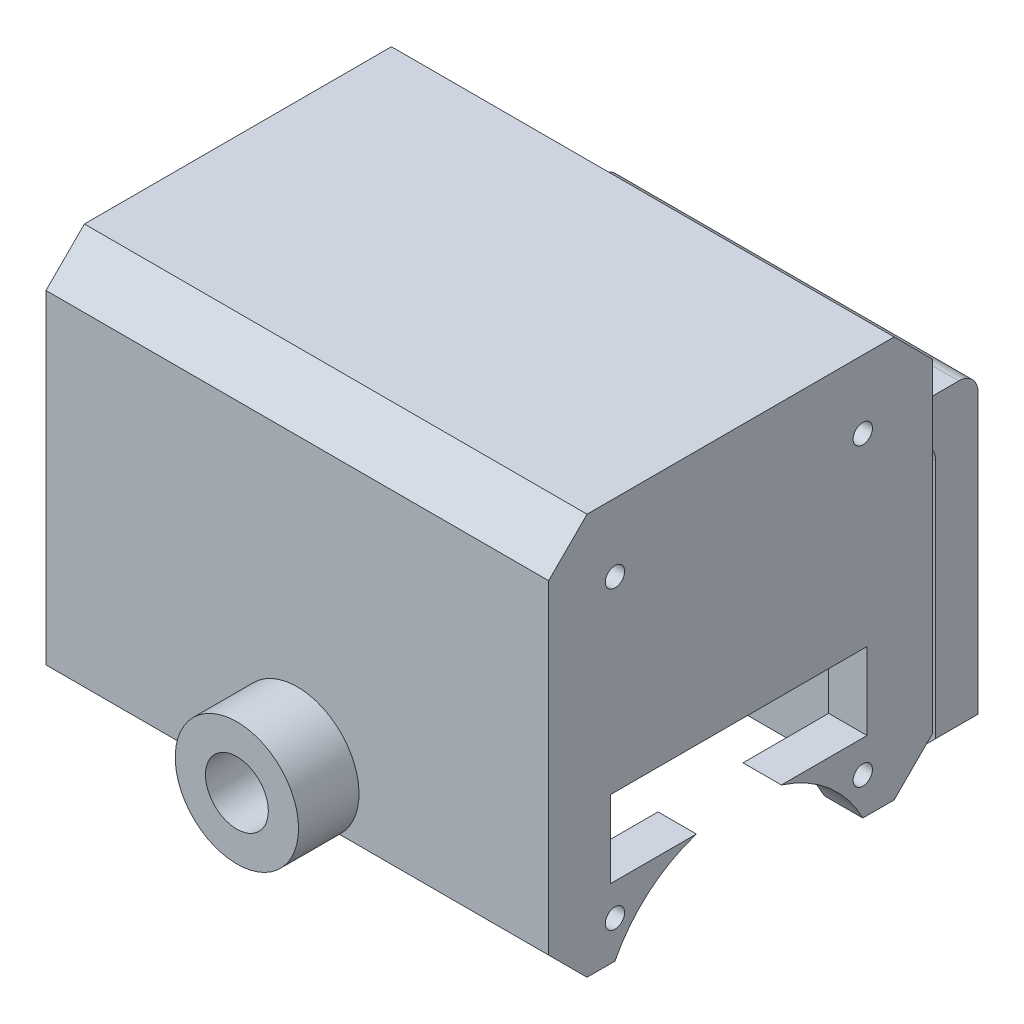
from build123d import *

# Parameters (mm, degrees)
SKETCH1_W                       = 25
SKETCH1_H                       = 30
BOSS_EXTRUDE1_DEPTH             = 3.175
SKETCH2_W                       = 25
SKETCH2_H                       = 3.175
BOSS_EXTRUDE2_DEPTH             = 41.58
SKETCH3_W                       = 3.175
SKETCH3_H                       = 25
BOSS_EXTRUDE3_DEPTH             = 30
CUT_EXTRUDE1_REACH              = 60.775
SKETCH4_R                       = 11.5
CUT_EXTRUDE2_REACH              = 60.775
SKETCH5_R                       = 0.8
CUT_EXTRUDE3_REACH              = 60.775
SKETCH6_R                       = 0.8
SKETCH6_R_2                     = 0.799851166
SKETCH6_W                       = 21.2
SKETCH6_H                       = 6.375
CUT_EXTRUDE4_REACH              = 60.775
SKETCH7_R                       = 11.5
BOSS_EXTRUDE4_DEPTH             = 0.2
SKETCH9_W                       = 41.58
SKETCH9_H                       = 33.175
BOSS_EXTRUDE5_DEPTH             = 3.175
BOSS_EXTRUDE6_DEPTH             = 0.2
SKETCH11_W                      = 41.58
SKETCH11_H                      = 33.175
BOSS_EXTRUDE7_DEPTH             = 3.175
CHAMFER1_SIZE                   = 3.175
CHAMFER2_SIZE                   = 3.175
SKETCH13_W                      = 29.58
SKETCH13_H                      = 3.175
BOSS_EXTRUDE8_DEPTH             = 6.59
BOSS_EXTRUDE9_REACH             = 59.287
SKETCH14_W                      = 29.58
SKETCH14_H                      = 3.5
BOSS_EXTRUDE9_DIRECTION_2_DEPTH = 25
CHAMFER3_SIZE                   = 3.5
FILLET1_R                       = 1.5875
FILLET2_R                       = 1.5875
CUT_EXTRUDE5_REACH              = 69.476
SKETCH16_R                      = 4.6
SKETCH20_R                      = 8
SKETCH20_R_2                    = 2.6
BOSS_EXTRUDE11_DEPTH            = 5
CUT_EXTRUDE6_START              = -21.7275
SKETCH21_R                      = 1.025
CUT_EXTRUDE6_DEPTH              = 16
BOSS_EXTRUDE12_DEPTH            = 5
BOSS_EXTRUDE12_DEPTH_BACK       = 1.2
SKETCH23_R                      = 5.1
SKETCH23_R_2                    = 2.6


with BuildPart() as part:
    # Sketch1 → Boss-Extrude1 (new body)
    with BuildSketch(Plane(origin=(0, 0, 0), x_dir=(0, 0, -1), z_dir=(1, 0, 0))):
        with Locations((12.5, 15)):
            Rectangle(SKETCH1_W, SKETCH1_H)
    extrude(amount=BOSS_EXTRUDE1_DEPTH)

    # Sketch2 → Boss-Extrude2 (add)
    with BuildSketch(Plane.ZY):
        with Locations((-12.5, 31.5875)):
            Rectangle(SKETCH2_W, SKETCH2_H)
    extrude(amount=-BOSS_EXTRUDE2_DEPTH)

    # Sketch3 → Boss-Extrude3 (add)
    with BuildSketch(Plane.XZ.offset(-30)):
        with Locations((39.9925, -12.5)):
            Rectangle(SKETCH3_W, SKETCH3_H)
    extrude(amount=BOSS_EXTRUDE3_DEPTH)

    # Sketch4 → Cut-Extrude1 (cut, up to next)
    with BuildSketch(Plane.ZY, mode=Mode.PRIVATE) as cut_extrude1_sk1:
        with Locations((-12.359999929, -5.209996254)):
            Circle(SKETCH4_R)
    cut_extrude1_tool1 = extrude(cut_extrude1_sk1.sketch, amount=-CUT_EXTRUDE1_REACH, mode=Mode.PRIVATE) & part.part
    add(cut_extrude1_tool1.solids().sort_by_distance((0, -5.209996, -12.36))[0], mode=Mode.SUBTRACT)

    # Sketch5 → Cut-Extrude2 (cut, up to next)
    with BuildSketch(Plane.ZY, mode=Mode.PRIVATE) as cut_extrude2_sk1:
        with Locations((-22.609999929, 3.090003746)):
            Circle(SKETCH5_R)
    cut_extrude2_tool1 = extrude(cut_extrude2_sk1.sketch, amount=-CUT_EXTRUDE2_REACH, mode=Mode.PRIVATE) & part.part
    # Sketch5 → Cut-Extrude2 (cut, up to next)
    with BuildSketch(Plane.ZY, mode=Mode.PRIVATE) as cut_extrude2_sk2:
        with Locations((-22.609999929, 23.790003746)):
            Circle(SKETCH5_R)
    cut_extrude2_tool2 = extrude(cut_extrude2_sk2.sketch, amount=-CUT_EXTRUDE2_REACH, mode=Mode.PRIVATE) & part.part
    # Sketch5 → Cut-Extrude2 (cut, up to next)
    with BuildSketch(Plane.ZY, mode=Mode.PRIVATE) as cut_extrude2_sk3:
        with Locations((-2.109999929, 23.790003746)):
            Circle(SKETCH5_R)
    cut_extrude2_tool3 = extrude(cut_extrude2_sk3.sketch, amount=-CUT_EXTRUDE2_REACH, mode=Mode.PRIVATE) & part.part
    # Sketch5 → Cut-Extrude2 (cut, up to next)
    with BuildSketch(Plane.ZY, mode=Mode.PRIVATE) as cut_extrude2_sk4:
        with Locations((-2.109999929, 3.090003746)):
            Circle(SKETCH5_R)
    cut_extrude2_tool4 = extrude(cut_extrude2_sk4.sketch, amount=-CUT_EXTRUDE2_REACH, mode=Mode.PRIVATE) & part.part
    add(cut_extrude2_tool1.solids().sort_by_distance((0, 3.090004, -22.61))[0], mode=Mode.SUBTRACT)
    add(cut_extrude2_tool2.solids().sort_by_distance((0, 23.790004, -22.61))[0], mode=Mode.SUBTRACT)
    add(cut_extrude2_tool3.solids().sort_by_distance((0, 23.790004, -2.11))[0], mode=Mode.SUBTRACT)
    add(cut_extrude2_tool4.solids().sort_by_distance((0, 3.090004, -2.11))[0], mode=Mode.SUBTRACT)

    # Sketch6 → Cut-Extrude3 (cut, up to next)
    with BuildSketch(Plane(origin=(41.58, 0, 0), x_dir=(0, 0, -1), z_dir=(1, 0, 0)), mode=Mode.PRIVATE) as cut_extrude3_sk1:
        with Locations(Location((2.109999929, 3.090003746, 0), (0, 0, 180))):
            Circle(SKETCH6_R)
    cut_extrude3_tool1 = extrude(cut_extrude3_sk1.sketch, amount=-CUT_EXTRUDE3_REACH, mode=Mode.PRIVATE) & part.part
    # Sketch6 → Cut-Extrude3 (cut, up to next)
    with BuildSketch(Plane(origin=(41.58, 0, 0), x_dir=(0, 0, -1), z_dir=(1, 0, 0)), mode=Mode.PRIVATE) as cut_extrude3_sk2:
        with Locations(Location((22.609999929, 3.090003746, 0), (0, 0, 180))):
            Circle(SKETCH6_R)
    cut_extrude3_tool2 = extrude(cut_extrude3_sk2.sketch, amount=-CUT_EXTRUDE3_REACH, mode=Mode.PRIVATE) & part.part
    # Sketch6 → Cut-Extrude3 (cut, up to next)
    with BuildSketch(Plane(origin=(41.58, 0, 0), x_dir=(0, 0, -1), z_dir=(1, 0, 0)), mode=Mode.PRIVATE) as cut_extrude3_sk3:
        with Locations((22.609999929, 27.540003746)):
            Circle(SKETCH6_R_2)
    cut_extrude3_tool3 = extrude(cut_extrude3_sk3.sketch, amount=-CUT_EXTRUDE3_REACH, mode=Mode.PRIVATE) & part.part
    # Sketch6 → Cut-Extrude3 (cut, up to next)
    with BuildSketch(Plane(origin=(41.58, 0, 0), x_dir=(0, 0, -1), z_dir=(1, 0, 0)), mode=Mode.PRIVATE) as cut_extrude3_sk4:
        with Locations((2.109999929, 27.540003746)):
            Circle(SKETCH6_R)
    cut_extrude3_tool4 = extrude(cut_extrude3_sk4.sketch, amount=-CUT_EXTRUDE3_REACH, mode=Mode.PRIVATE) & part.part
    # Sketch6 → Cut-Extrude3 (cut, up to next)
    with BuildSketch(Plane(origin=(41.58, 0, 0), x_dir=(0, 0, -1), z_dir=(1, 0, 0)), mode=Mode.PRIVATE) as cut_extrude3_sk5:
        with Locations((12.359999929, 8.927503746)):
            Rectangle(SKETCH6_W, SKETCH6_H)
    cut_extrude3_tool5 = extrude(cut_extrude3_sk5.sketch, amount=-CUT_EXTRUDE3_REACH, mode=Mode.PRIVATE) & part.part
    add(cut_extrude3_tool1.solids().sort_by_distance((41.58, 3.090004, -2.11))[0], mode=Mode.SUBTRACT)
    add(cut_extrude3_tool2.solids().sort_by_distance((41.58, 3.090004, -22.61))[0], mode=Mode.SUBTRACT)
    add(cut_extrude3_tool3.solids().sort_by_distance((41.58, 27.540004, -22.61))[0], mode=Mode.SUBTRACT)
    add(cut_extrude3_tool4.solids().sort_by_distance((41.58, 27.540004, -2.11))[0], mode=Mode.SUBTRACT)
    add(cut_extrude3_tool5.solids().sort_by_distance((41.58, 8.927504, -12.36))[0], mode=Mode.SUBTRACT)

    # Sketch7 → Cut-Extrude4 (cut, up to next)
    with BuildSketch(Plane(origin=(41.58, 0, 0), x_dir=(0, 0, -1), z_dir=(1, 0, 0)), mode=Mode.PRIVATE) as cut_extrude4_sk1:
        with Locations((12.359999929, -5.209996254)):
            Circle(SKETCH7_R)
    cut_extrude4_tool1 = extrude(cut_extrude4_sk1.sketch, amount=-CUT_EXTRUDE4_REACH, mode=Mode.PRIVATE) & part.part
    add(cut_extrude4_tool1.solids().sort_by_distance((41.58, -5.209996, -12.36))[0], mode=Mode.SUBTRACT)

    # Sketch8 → Boss-Extrude4 (add)
    with BuildSketch(Plane.XY):
        Polygon((0, 33.175), (0, 0), (3.175, 0), (3.175, 30), (38.405, 30), (38.405, 0), (41.58, 0), (41.58, 33.175), align=None)
    extrude(amount=BOSS_EXTRUDE4_DEPTH)

    # Sketch9 → Boss-Extrude5 (add)
    with BuildSketch(Plane.XY.offset(0.2)):
        with Locations((20.79, 16.5875)):
            Rectangle(SKETCH9_W, SKETCH9_H)
    extrude(amount=BOSS_EXTRUDE5_DEPTH)

    # Sketch10 → Boss-Extrude6 (add)
    with BuildSketch(Plane(origin=(0, 0, -25), x_dir=(-1, 0, 0), z_dir=(0, 0, -1))):
        Polygon((0, 0), (0, 33.175), (-41.58, 33.175), (-41.58, 0), (-38.405, 0), (-38.405, 30), (-3.175, 30), (-3.175, 0), align=None)
    extrude(amount=BOSS_EXTRUDE6_DEPTH)

    # Sketch11 → Boss-Extrude7 (add)
    with BuildSketch(Plane(origin=(0, 0, -25.2), x_dir=(-1, 0, 0), z_dir=(0, 0, -1))):
        with Locations((-20.79, 16.5875)):
            Rectangle(SKETCH11_W, SKETCH11_H)
    extrude(amount=BOSS_EXTRUDE7_DEPTH)

    # Chamfer1
    chamfer1_edges = [part.edges().sort_by_distance(p)[0] for p in [
        (20.79, 33.175, 3.375),
        (20.79, 33.175, -28.375),
    ]]
    chamfer(chamfer1_edges, length=CHAMFER1_SIZE)

    # Chamfer2
    chamfer2_edges = [part.edges().sort_by_distance(p)[0] for p in [
        (20.79, 0, 3.375),
        (20.79, 0, -28.375),
    ]]
    chamfer(chamfer2_edges, length=CHAMFER2_SIZE - 0.0001)  # a hair under: the kernel refuses the full size

    # Sketch13 → Boss-Extrude8 (add)
    with BuildSketch(Plane(origin=(0, 0, -28.375), x_dir=(-1, 0, 0), z_dir=(0, 0, -1))):
        with Locations((-20.79, 19.7625)):
            Rectangle(SKETCH13_W, SKETCH13_H)
    extrude(amount=BOSS_EXTRUDE8_DEPTH)

    # Boss-Extrude9: up to this face of the body (flat: up to its plane)
    boss_extrude9_end = Plane(part.part.faces().sort_by_distance((20.79, 21.35, -31.67))[0])
    # Sketch14 → Boss-Extrude9 (add, up to the picked face)
    with BuildSketch(Plane.XZ.offset(-18.175), mode=Mode.PRIVATE) as boss_extrude9_sk1:
        with Locations((20.79, -36.39)):
            Rectangle(SKETCH14_W, SKETCH14_H)
    boss_extrude9_tool1 = split(extrude(boss_extrude9_sk1.sketch, amount=-BOSS_EXTRUDE9_REACH, mode=Mode.PRIVATE), bisect_by=boss_extrude9_end, keep=Keep.BOTH, mode=Mode.PRIVATE)
    add(boss_extrude9_tool1.solids().sort_by(Axis((20.79, 18.175, -36.39), (0, 1, 0)))[0])

    # Sketch14 → Boss-Extrude9 direction 2 (add)
    with BuildSketch(Plane.XZ.offset(-18.175)):
        with Locations((20.79, -36.39)):
            Rectangle(SKETCH14_W, SKETCH14_H)
    extrude(amount=BOSS_EXTRUDE9_DIRECTION_2_DEPTH)

    # Chamfer3
    chamfer3_edges = [part.edges().sort_by_distance(p)[0] for p in [
        (6, -6.825, -36.39),
        (35.58, -6.825, -36.39),
    ]]
    chamfer(chamfer3_edges, length=CHAMFER3_SIZE)

    # Fillet1
    fillet1_edges = [part.edges().sort_by_distance(p)[0] for p in [
        (20.79, 18.175, -34.64),
        (20.79, 21.35, -38.14),
    ]]
    fillet(fillet1_edges, radius=FILLET1_R)

    # Fillet2
    fillet2_edges = [part.edges().sort_by_distance(p)[0] for p in [
        (20.79, 21.35, -28.375),
    ]]
    fillet(fillet2_edges, radius=FILLET2_R)

    # Sketch16 → Cut-Extrude5 (cut, up to next)
    with BuildSketch(Plane(origin=(0, 0, -38.14), x_dir=(-1, 0, 0), z_dir=(0, 0, -1)), mode=Mode.PRIVATE) as cut_extrude5_sk1:
        with Locations((-20.79, 6.9025)):
            Circle(SKETCH16_R)
    cut_extrude5_tool1 = extrude(cut_extrude5_sk1.sketch, amount=-CUT_EXTRUDE5_REACH, mode=Mode.PRIVATE) & part.part
    add(cut_extrude5_tool1.solids().sort_by_distance((20.79, 6.9025, -38.14))[0], mode=Mode.SUBTRACT)

    # Sketch20 → Boss-Extrude11 (add)
    with BuildSketch(Plane.XY.offset(-34.64)):
        with Locations(Location((20.79, 6.9025, 0), (0, 0, 180))):
            Circle(SKETCH20_R)
        with Locations((20.79, 6.9025)):
            Circle(SKETCH20_R_2, mode=Mode.SUBTRACT)
    extrude(amount=BOSS_EXTRUDE11_DEPTH)

    # Sketch21 → Cut-Extrude6 (cut)
    with BuildSketch(Plane.XZ.offset(6.825).offset(CUT_EXTRUDE6_START)):
        with Locations(Location((20.79, -32.14, 0), (0, 0, 270))):
            Circle(SKETCH21_R)
    extrude(amount=CUT_EXTRUDE6_DEPTH, mode=Mode.SUBTRACT)

    # Sketch23 → Boss-Extrude12 (add, two sides: drawn at the far end of the back side and taken through both)
    with BuildSketch(Plane.XY.offset(3.375).offset(-BOSS_EXTRUDE12_DEPTH_BACK)):
        with Locations(Location((20.79, 6.9025, 0), (0, 0, 226.960415899))):
            Circle(SKETCH23_R)
        with Locations((20.79, 6.9025)):
            Circle(SKETCH23_R_2, mode=Mode.SUBTRACT)
    extrude(amount=BOSS_EXTRUDE12_DEPTH + BOSS_EXTRUDE12_DEPTH_BACK)


solid = part.part
